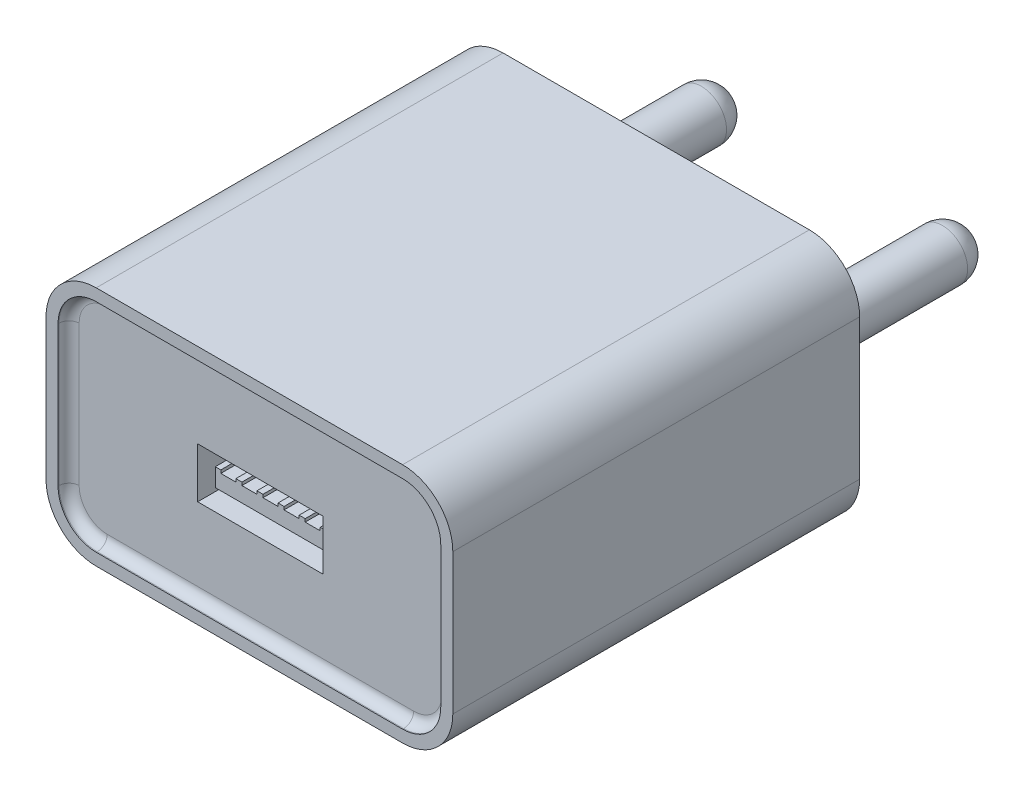
from build123d import *

# Parameters (mm, degrees)
SKETCH1_W           = 40.5
SKETCH1_H           = 24
BOSS_EXTRUDE1_DEPTH = 20.25
FILLET1_R           = 5
CUT_EXTRUDE7_DEPTH  = 1.1
FILLET2_R           = 1
SKETCH14_R          = 2.5
BOSS_EXTRUDE3_DEPTH = 16.5
SKETCH15_W          = 12.5
SKETCH15_H          = 5
CUT_EXTRUDE8_DEPTH  = 12
SKETCH17_W          = 11
SKETCH17_H          = 1.8
BOSS_EXTRUDE4_DEPTH = 11
SKETCH18_W          = 1.5
SKETCH18_H          = 0.4
CUT_EXTRUDE9_DEPTH  = 2
LPATTERN1_COUNT     = 3
LPATTERN1_PITCH     = 2.1
LPATTERN1_COL_COUNT = 3
LPATTERN1_COL_PITCH = 2.1


# Read off the part's stored shape, not the designer's step: Dome1, Dome2
with BuildPart() as part:
    # Sketch1 → Boss-Extrude1 (new, symmetric)
    with BuildSketch(Plane.XY):
        Rectangle(SKETCH1_W, SKETCH1_H)
    extrude(amount=BOSS_EXTRUDE1_DEPTH, both=True)

    # Fillet1
    fillet1_edges = [part.edges().sort_by_distance(p)[0] for p in [
        (20.25, -12, 0),
        (-20.25, -12, 0),
        (-20.25, 12, 0),
        (20.25, 12, 0),
    ]]
    fillet(fillet1_edges, radius=FILLET1_R)

    # Sketch13 → Cut-Extrude7 (cut)
    with BuildSketch(Plane.XY.offset(20.25)):
        with BuildLine():
            Line((-19.05, 7), (-19.05, -7))
            ThreePointArc((-19.05, -7), (-17.937005769, -9.687005769), (-15.25, -10.8))
            Line((-15.25, -10.8), (15.25, -10.8))
            ThreePointArc((15.25, -10.8), (17.937005769, -9.687005769), (19.05, -7))
            Line((19.05, -7), (19.05, 7))
            ThreePointArc((19.05, 7), (17.937005769, 9.687005769), (15.25, 10.8))
            Line((15.25, 10.8), (-15.25, 10.8))
            ThreePointArc((-15.25, 10.8), (-17.937005769, 9.687005769), (-19.05, 7))
        make_face()
    extrude(amount=-CUT_EXTRUDE7_DEPTH, mode=Mode.SUBTRACT)

    # Fillet2
    fillet2_edges = [part.edges().sort_by_distance(p)[0] for p in [
        (-19.05, 0, 19.15),
        (-17.937005769, 9.687005769, 19.15),
        (0, 10.8, 19.15),
        (17.937005769, 9.687005769, 19.15),
        (19.05, 0, 19.15),
        (17.937005769, -9.687005769, 19.15),
        (0, -10.8, 19.15),
        (-17.937005769, -9.687005769, 19.15),
    ]]
    fillet(fillet2_edges, radius=FILLET2_R)

    # Sketch14 → Boss-Extrude3 (add)
    with BuildSketch(Plane(origin=(0, 0, -20.25), x_dir=(-1, 0, 0), z_dir=(0, 0, -1))):
        with Locations(Location((-12, 0, 0), (0, 0, 180))):
            Circle(SKETCH14_R)
        with Locations(Location((12, 0, 0), (0, 0, 180))):
            Circle(SKETCH14_R)
    extrude(amount=BOSS_EXTRUDE3_DEPTH)

    # Dome1 outline → Dome1 (revolve)
    with BuildSketch(Plane(origin=(12, 0, 0), x_dir=(1, 0, 0), z_dir=(0, -1, 0))):
        with BuildLine():
            Line((0, -36.749999997), (0, -39.25))
            ThreePointArc((0, -39.25), (1.767766954, -38.517766952), (2.5, -36.749999997))
            Line((2.5, -36.749999997), (0, -36.749999997))
        make_face()
    revolve(axis=Axis((12, 0, 0), (0, 0, 1)))

    # Dome2 outline → Dome2 (revolve)
    with BuildSketch(Plane(origin=(-12, 0, 0), x_dir=(1, 0, 0), z_dir=(0, -1, 0))):
        with BuildLine():
            Line((0, -36.749999997), (0, -39.25))
            ThreePointArc((0, -39.25), (1.767766954, -38.517766952), (2.5, -36.749999997))
            Line((2.5, -36.749999997), (0, -36.749999997))
        make_face()
    revolve(axis=Axis((-12, 0, 0), (0, 0, 1)))

    # Sketch15 → Cut-Extrude8 (cut)
    with BuildSketch(Plane.XY.offset(19.15)):
        Rectangle(SKETCH15_W, SKETCH15_H)
    extrude(amount=-CUT_EXTRUDE8_DEPTH, mode=Mode.SUBTRACT)

    # Sketch17 → Boss-Extrude4 (add)
    with BuildSketch(Plane.XY.offset(7.15)):
        with Locations((0, -0.5)):
            Rectangle(SKETCH17_W, SKETCH17_H)
    extrude(amount=BOSS_EXTRUDE4_DEPTH)

    # Sketch18 → Cut-Extrude9 (cut)
    with BuildSketch(Plane.XY.offset(18.15)):
        with Locations((0, 0.3)):
            Rectangle(SKETCH18_W, SKETCH18_H)
    cut_extrude9 = extrude(amount=-CUT_EXTRUDE9_DEPTH, mode=Mode.SUBTRACT)

    # LPattern1: Cut-Extrude9 ×3
    with Locations(*[(i * LPATTERN1_PITCH, 0, 0) for i in range(1, LPATTERN1_COUNT)]):
        add(cut_extrude9, mode=Mode.SUBTRACT)

    # LPattern1 col: Cut-Extrude9 ×3
    with Locations(*[(-i * LPATTERN1_COL_PITCH, 0, 0) for i in range(1, LPATTERN1_COL_COUNT)]):
        add(cut_extrude9, mode=Mode.SUBTRACT)


solid = part.part
